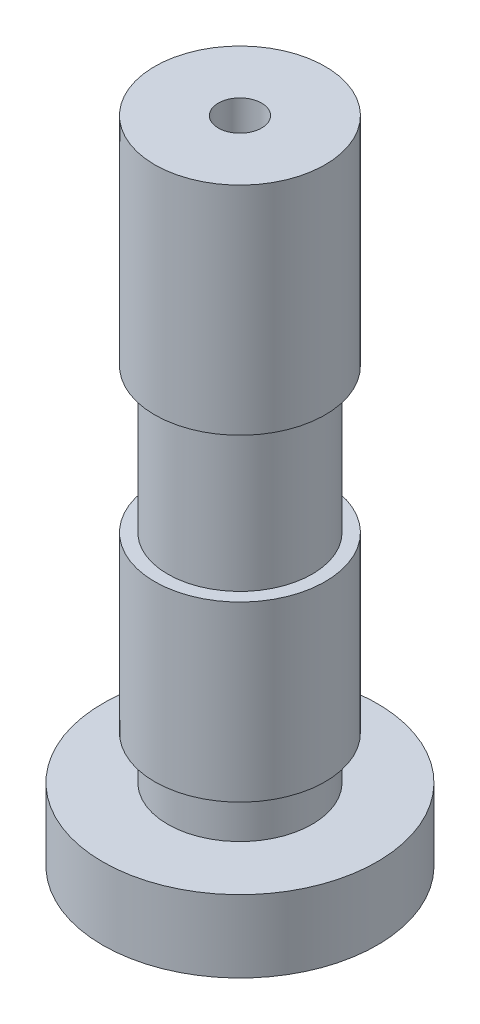
from build123d import *

# Parameters (mm, degrees)
SKETCH_2_R          = 1.5
CUT_EXTRUDE_1_DEPTH = 3
CUT_EXTRUDE_START   = -3
SKETCH_3_R          = 1.5
CUT_EXTRUDE_2_DEPTH = 3


with BuildPart() as part:
    # Эскиз1 → Повернуть1 (revolve)
    with BuildSketch(Plane.XY):
        Polygon((0, 0), (9.5, 0), (9.5, 5), (5, 5), (5, 8), (5.9, 8), (5.9, 20), (5, 20), (5, 30), (5.9, 30), (5.9, 45), (0, 45), align=None)
    revolve(axis=Axis((0, 14.6467512, 0), (0, -1, 0)))

    # Эскиз2 → Вырез-Вытянуть1 (cut)
    with BuildSketch(Plane(origin=(0, 45, 0), x_dir=(1, 0, 0), z_dir=(0, 1, 0))):
        Circle(SKETCH_2_R)
    extrude(amount=-CUT_EXTRUDE_1_DEPTH, mode=Mode.SUBTRACT)

    # Эскиз3 → Вырез-Вытянуть2 (cut)
    with BuildSketch(Plane(origin=(0, 0, 0), x_dir=(-1, 0, 0), z_dir=(0, -1, 0)).offset(CUT_EXTRUDE_START)):
        Circle(SKETCH_3_R)
    extrude(amount=CUT_EXTRUDE_2_DEPTH, mode=Mode.SUBTRACT)


solid = part.part
